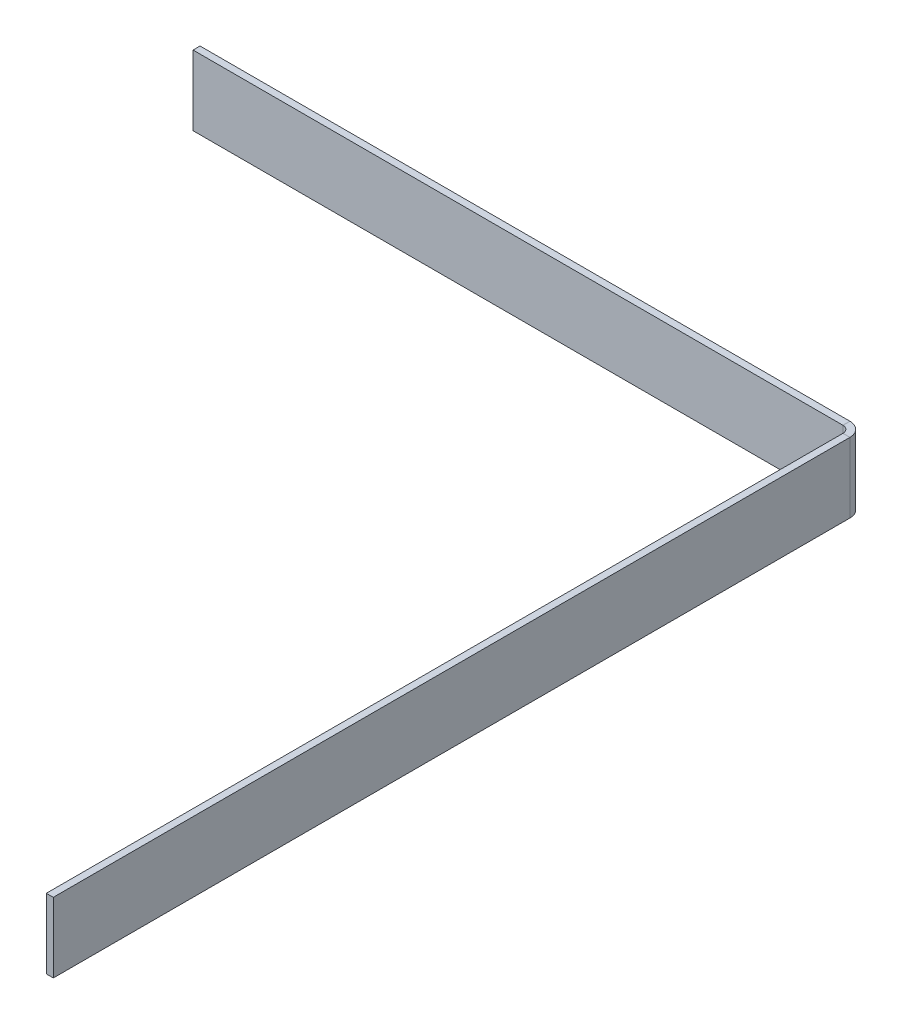
from build123d import *

# Parameters (mm, degrees)
SKETCH_1_W                       = 190
SKETCH_1_H                       = 20
EXTRUDE_2_DEPTH                  = 2
SM_EDGE_FLANGE_2_STRIP_W         = 12
SM_EDGE_FLANGE_2_STRIP_H         = 2
SM_EDGE_FLANGE_2_STRIP_CUT_DEPTH = 20
SM_EDGE_FLANGE_2_DEPTH           = 20


# Sheet-metal steps are written as plain solids
with BuildPart() as part:
    # Эскиз1 → Бобышка-Вытянуть2 (new body)
    with BuildSketch(Plane.XY):
        with Locations((95, 10)):
            Rectangle(SKETCH_1_W, SKETCH_1_H)
    extrude(amount=EXTRUDE_2_DEPTH)

    # Ребро-кромка2 strip (across the edge) → Ребро-кромка2 strip cut (cut)
    with BuildSketch(Plane(origin=(190, 0, 2), x_dir=(-1, 0, 0), z_dir=(0, 1, 0))):
        with Locations((-2, -1)):
            Rectangle(SM_EDGE_FLANGE_2_STRIP_W, SM_EDGE_FLANGE_2_STRIP_H)
    extrude(amount=SM_EDGE_FLANGE_2_STRIP_CUT_DEPTH, mode=Mode.SUBTRACT)

    # Ребро-кромка2 section (across the edge) → Ребро-кромка2 (add)
    with BuildSketch(Plane(origin=(190, 0, 2), x_dir=(-1, 0, 0), z_dir=(0, 1, 0))):
        with BuildLine():
            Line((0, 2), (0, 230))
            Line((0, 230), (2, 230))
            Line((2, 230), (2, 2))
            ThreePointArc((2, 2), (2.585786438, 0.585786438), (4, 0))
            Line((4, 0), (4, -2))
            ThreePointArc((4, -2), (1.171572875, -0.828427125), (0, 2))
        make_face()
    extrude(amount=SM_EDGE_FLANGE_2_DEPTH)


solid = part.part
